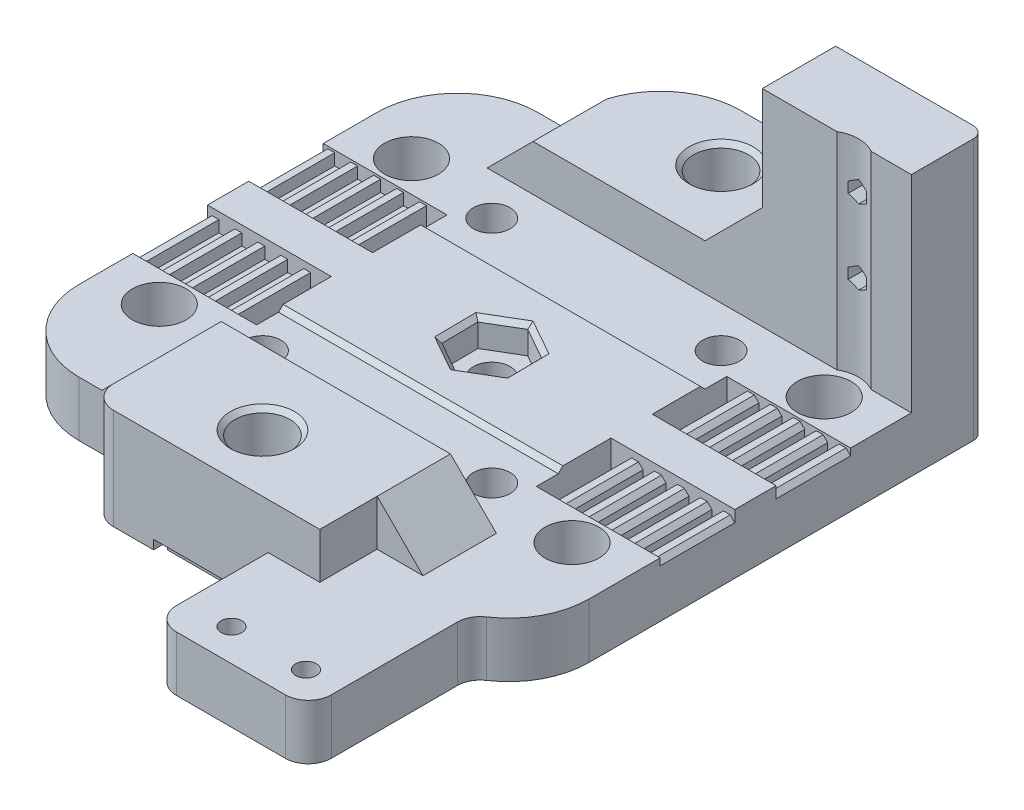
from build123d import *
from build123d.topology import SkipClean

# Parameters (mm, degrees)
SKETCH_1_W           = 40
SKETCH_1_H           = 40
EXTRUDE_1_DEPTH      = 4.8
SKETCH_2_R           = 1.6
CUT_EXTRUDE_1_DEPTH  = 57.771823997
SKETCH_3_W           = 40
SKETCH_3_H           = 12.8
EXTRUDE_2_DEPTH      = 0.4
CHAMFER_1_SIZE       = 0.4
SKETCH_4_W           = 20
SKETCH_4_H           = 5
EXTRUDE_3_DEPTH      = 4.8
SKETCH_5_R           = 1.6
CUT_EXTRUDE_2_DEPTH  = 61.43211067
SKETCH_6_W           = 9
SKETCH_6_H           = 50
CUT_EXTRUDE_4_DEPTH  = 0.8
SKETCH_7_W           = 20
SKETCH_7_H           = 11.5
SKETCH_7_R           = 1.6
EXTRUDE_4_DEPTH      = 4
SKETCH_8_R           = 2.4
CUT_EXTRUDE_5_DEPTH  = 4.4
CHAMFER_2_SIZE       = 0.4
CUT_EXTRUDE_6_DEPTH  = 2.4
CHAMFER_3_SIZE       = 0.4
EXTRUDE_5_DEPTH      = 3
EXTRUDE_6_DEPTH      = 3
SKETCH_12_W          = 1
SKETCH_12_H          = 6.5
CUT_EXTRUDE_7_DEPTH  = 1
SKETCH_13_W          = 1.8
SKETCH_13_H          = 6.5
CUT_EXTRUDE_8_DEPTH  = 63.860480431
SKETCH_14_W          = 10.8
SKETCH_14_H          = 6.5
SKETCH_14_H_2        = 6.513163602
CUT_EXTRUDE_9_DEPTH  = 0.6
SKETCH_15_W          = 1
SKETCH_15_H          = 6.5
CUT_EXTRUDE_10_DEPTH = 1
EXTRUDE_7_DEPTH      = 10
SKETCH_17_R          = 0.9
CUT_EXTRUDE_11_DEPTH = 71.366469288
SKETCH_18_W          = 7.5
SKETCH_18_H          = 4
CUT_EXTRUDE_12_DEPTH = 70.978853949
CHAMFER_4_SIZE       = 3
CHAMFER_4_SIZE2      = 1.091910703
SKETCH_20_W          = 7.8
SKETCH_20_H          = 48.8
EXTRUDE_9_DEPTH      = 0.6
SKETCH_21_W          = 0.8
SKETCH_21_H          = 0.2
SKETCH_21_W_2        = 0.4
CUT_EXTRUDE_13_DEPTH = 49
CHAMFER_5_SIZE       = 0.2
CHAMFER_6_SIZE       = 0.4
SKETCH_22_R          = 1.6
CUT_EXTRUDE_14_DEPTH = 10
SKETCH_24_R          = 2.35
CUT_EXTRUDE_15_DEPTH = 4
CHAMFER_8_SIZE       = 4
EXTRUDE_11_DEPTH     = 18
CHAMFER_11_SIZE      = 5
CHAMFER_12_SIZE      = 5
CHAMFER_13_SIZE      = 5
CUT_EXTRUDE_16_DEPTH = 15
SKETCH_29_W          = 5
SKETCH_29_H          = 4.8
EXTRUDE_13_DEPTH     = 9
SKETCH_30_W          = 15.5
SKETCH_30_H          = 10
CUT_EXTRUDE_17_DEPTH = 10
FILLET_1_R           = 2
FILLET_2_R           = 1
FILLET_3_R           = 7
FILLET_START         = -1
FILLET_4_DEPTH       = 14.8
SKETCH_32_W          = 28
SKETCH_32_H          = 0.1
SKETCH_32_W_2        = 37
CUT_EXTRUDE_18_DEPTH = 73.097156832


with BuildPart() as part:
    # 草图1 → 凸台-拉伸1 (new body)
    with BuildSketch(Plane(origin=(0, 0, 0), x_dir=(1, 0, 0), z_dir=(0, 1, 0))):
        with Locations((20, -20)):
            Rectangle(SKETCH_1_W, SKETCH_1_H)
    extrude(amount=EXTRUDE_1_DEPTH)

    # 草图2 → 切除-拉伸1 (cut, through all)
    with BuildSketch(Plane(origin=(0, 4.8, 0), x_dir=(1, 0, 0), z_dir=(0, 1, 0))):
        with Locations(Location((10, -30, 0), (0, 0, 270))):
            Circle(SKETCH_2_R)
        with Locations(Location((30, -30, 0), (0, 0, 270))):
            Circle(SKETCH_2_R)
        with Locations(Location((30, -10, 0), (0, 0, 270))):
            Circle(SKETCH_2_R)
        with Locations(Location((10, -10, 0), (0, 0, 270))):
            Circle(SKETCH_2_R)
    extrude(amount=-CUT_EXTRUDE_1_DEPTH, mode=Mode.SUBTRACT)

    # 草图3 → 凸台-拉伸2 (add)
    with BuildSketch(Plane(origin=(0, 4.8, 0), x_dir=(1, 0, 0), z_dir=(0, 1, 0))):
        with Locations((20, -20)):
            Rectangle(SKETCH_3_W, SKETCH_3_H)
    extrude(amount=EXTRUDE_2_DEPTH)

    # 倒角1
    chamfer_1_edges = [part.edges().sort_by_distance(p)[0] for p in [
        (20, 5.2, 26.4),
        (20, 5.2, 13.6),
    ]]
    chamfer(chamfer_1_edges, length=CHAMFER_1_SIZE - 0.0001)  # a hair under: the kernel refuses the full size

    # 草图4 → 凸台-拉伸3 (add)
    with BuildSketch(Plane.XZ):
        with Locations((20, 42.5)):
            Rectangle(SKETCH_4_W, SKETCH_4_H)
        with Locations((20, -2.5)):
            Rectangle(SKETCH_4_W, SKETCH_4_H)
    extrude(amount=-EXTRUDE_3_DEPTH)

    # 草图5 → 切除-拉伸2 (cut, through all)
    with BuildSketch(Plane(origin=(0, 0, 0), x_dir=(-1, 0, 0), z_dir=(0, -1, 0))):
        with Locations(Location((-20, -20, 0), (0, 0, 90))):
            Circle(SKETCH_5_R)
        with Locations(Location((-20, 0, 0), (0, 0, 90))):
            Circle(SKETCH_5_R)
        with Locations(Location((-20, -40, 0), (0, 0, 90))):
            Circle(SKETCH_5_R)
    extrude(amount=-CUT_EXTRUDE_2_DEPTH, mode=Mode.SUBTRACT)

    # 草图6 → 切除-拉伸4 (cut)
    with BuildSketch(Plane(origin=(0, 0, 0), x_dir=(-1, 0, 0), z_dir=(0, -1, 0))):
        with Locations((-20, -20)):
            Rectangle(SKETCH_6_W, SKETCH_6_H)
    extrude(amount=-CUT_EXTRUDE_4_DEPTH, mode=Mode.SUBTRACT)

    # 草图7 → 凸台-拉伸4 (add)
    # profile 1 of 2: a face of its own
    with BuildSketch(Plane(origin=(0, 4.8, 0), x_dir=(1, 0, 0), z_dir=(0, 1, 0))):
        with Locations((20, -0.75)):
            Rectangle(SKETCH_7_W, SKETCH_7_H)
        with Locations(Location((20, 0, 0), (0, 0, 90))):
            Circle(SKETCH_7_R, mode=Mode.SUBTRACT)
    # profile 2 of 2: a face of its own
    with BuildSketch(Plane(origin=(0, 4.8, 0), x_dir=(1, 0, 0), z_dir=(0, 1, 0))):
        with Locations((20, -39.25)):
            Rectangle(SKETCH_7_W, SKETCH_7_H)
        with Locations(Location((20, -40, 0), (0, 0, 90))):
            Circle(SKETCH_7_R, mode=Mode.SUBTRACT)
    extrude(amount=EXTRUDE_4_DEPTH)

    # 草图8 → 切除-拉伸5 (cut)
    with BuildSketch(Plane(origin=(0, 8.8, 0), x_dir=(1, 0, 0), z_dir=(0, 1, 0))):
        with Locations(Location((20, 0, 0), (0, 0, 270))):
            Circle(SKETCH_8_R)
        with Locations(Location((20, -40, 0), (0, 0, 270))):
            Circle(SKETCH_8_R)
    extrude(amount=-CUT_EXTRUDE_5_DEPTH, mode=Mode.SUBTRACT)

    # 倒角2
    chamfer_2_edges = [part.edges().sort_by_distance(p)[0] for p in [
        (20, 8.8, -2.4),
        (20, 8.8, 37.6),
    ]]
    chamfer(chamfer_2_edges, length=CHAMFER_2_SIZE)

    # 草图9 → 切除-拉伸6 (cut)
    with BuildSketch(Plane(origin=(0, 5.2, 0), x_dir=(1, 0, 0), z_dir=(0, 1, 0))):
        Polygon((22.76762404, -21.556788523), (22.732030429, -18.381561534), (19.964406389, -16.824773012), (17.23237596, -18.443211477), (17.267969571, -21.618438466), (20.035593611, -23.175226988), align=None)
    extrude(amount=-CUT_EXTRUDE_6_DEPTH, mode=Mode.SUBTRACT)

    # 倒角3
    chamfer_3_edges = [part.edges().sort_by_distance(p)[0] for p in [
        (21.401608826, 5.2, 22.366007756),
        (22.749827235, 5.2, 19.969175028),
        (21.348218409, 5.2, 17.603167273),
        (18.598391174, 5.2, 17.633992244),
        (17.250172765, 5.2, 20.030824972),
        (18.651781591, 5.2, 22.396832727),
    ]]
    chamfer(chamfer_3_edges, length=CHAMFER_3_SIZE)

    # 草图10 → 凸台-拉伸5 (add)
    with SkipClean():  # the faces are left unmerged after this step: merging them gives an invalid solid
        with BuildSketch(Plane(origin=(40, 0, 0), x_dir=(0, 0, -1), z_dir=(1, 0, 0))):
            Polygon((-14, 5.2), (-26, 5.2), (-26.4, 4.8), (-40, 4.8), (-40, 0), (0, 0), (0, 4.8), (-13.6, 4.8), align=None)
        extrude(amount=EXTRUDE_5_DEPTH)

    # 草图11 → 凸台-拉伸6 (add)
    with SkipClean():  # the faces are left unmerged after this step: merging them gives an invalid solid
        with BuildSketch(Plane.ZY):
            Polygon((40, 4.8), (26.4, 4.8), (26, 5.2), (14, 5.2), (13.6, 4.8), (0, 4.8), (0, 0), (40, 0), align=None)
        extrude(amount=EXTRUDE_6_DEPTH)

    # 草图12 → 切除-拉伸7 (cut)
    with SkipClean():  # the faces are left unmerged after this step: merging them gives an invalid solid
        with BuildSketch(Plane(origin=(0, 0, 0), x_dir=(-1, 0, 0), z_dir=(0, -1, 0))):
            with Locations((-0.5, -25.05)):
                Rectangle(SKETCH_12_W, SKETCH_12_H)
            with Locations((1.5, -25.05)):
                Rectangle(SKETCH_12_W, SKETCH_12_H)
            with Locations((-2.5, -25.05)):
                Rectangle(SKETCH_12_W, SKETCH_12_H)
            with Locations((-4.5, -25.05)):
                Rectangle(SKETCH_12_W, SKETCH_12_H)
            with Locations((-4.5, -14.95)):
                Rectangle(SKETCH_12_W, SKETCH_12_H)
            with Locations((-2.5, -14.95)):
                Rectangle(SKETCH_12_W, SKETCH_12_H)
            with Locations((-0.5, -14.95)):
                Rectangle(SKETCH_12_W, SKETCH_12_H)
            with Locations((1.5, -14.95)):
                Rectangle(SKETCH_12_W, SKETCH_12_H)
            with Locations((-35.5, -14.95)):
                Rectangle(SKETCH_12_W, SKETCH_12_H)
            with Locations((-37.5, -14.95)):
                Rectangle(SKETCH_12_W, SKETCH_12_H)
            with Locations((-39.5, -14.95)):
                Rectangle(SKETCH_12_W, SKETCH_12_H)
            with Locations((-41.5, -14.95)):
                Rectangle(SKETCH_12_W, SKETCH_12_H)
            with Locations((-35.5, -25.05)):
                Rectangle(SKETCH_12_W, SKETCH_12_H)
            with Locations((-37.5, -25.05)):
                Rectangle(SKETCH_12_W, SKETCH_12_H)
            with Locations((-39.5, -25.05)):
                Rectangle(SKETCH_12_W, SKETCH_12_H)
            with Locations((-41.5, -25.05)):
                Rectangle(SKETCH_12_W, SKETCH_12_H)
            with Locations((-6.5, -25.05)):
                Rectangle(SKETCH_12_W, SKETCH_12_H)
            with Locations((-6.5, -14.95)):
                Rectangle(SKETCH_12_W, SKETCH_12_H)
            with Locations((-33.5, -14.95)):
                Rectangle(SKETCH_12_W, SKETCH_12_H)
            with Locations((-33.5, -25.05)):
                Rectangle(SKETCH_12_W, SKETCH_12_H)
        extrude(amount=-CUT_EXTRUDE_7_DEPTH, mode=Mode.SUBTRACT)

    # 草图13 → 切除-拉伸8 (cut, through all)
    with SkipClean():  # the faces are left unmerged after this step: merging them gives an invalid solid
        with BuildSketch(Plane(origin=(0, 0, 0), x_dir=(-1, 0, 0), z_dir=(0, -1, 0))):
            with Locations((-33.1, -14.95)):
                Rectangle(SKETCH_13_W, SKETCH_13_H)
            with Locations((-33.1, -25.05)):
                Rectangle(SKETCH_13_W, SKETCH_13_H)
            with Locations((-6.9, -14.95)):
                Rectangle(SKETCH_13_W, SKETCH_13_H)
            with Locations((-6.9, -25.05)):
                Rectangle(SKETCH_13_W, SKETCH_13_H)
        extrude(amount=-CUT_EXTRUDE_8_DEPTH, mode=Mode.SUBTRACT)

    # 草图14 → 切除-拉伸9 (cut)
    with BuildSketch(Plane(origin=(0, 5.2, 0), x_dir=(1, 0, 0), z_dir=(0, 1, 0))):
        with Locations((2.4, -14.95)):
            Rectangle(SKETCH_14_W, SKETCH_14_H)
        with Locations((2.4, -25.056581801)):
            Rectangle(SKETCH_14_W, SKETCH_14_H_2)
        with Locations((37.6, -14.95)):
            Rectangle(SKETCH_14_W, SKETCH_14_H)
        with Locations((37.6, -25.056581801)):
            Rectangle(SKETCH_14_W, SKETCH_14_H_2)
    extrude(amount=-CUT_EXTRUDE_9_DEPTH, mode=Mode.SUBTRACT)

    # 草图15 → 切除-拉伸10 (cut)
    with BuildSketch(Plane(origin=(0, 4.6, 0), x_dir=(1, 0, 0), z_dir=(0, 1, 0))):
        with Locations((-1.5, -14.95)):
            Rectangle(SKETCH_15_W, SKETCH_15_H)
        with Locations((0.5, -14.95)):
            Rectangle(SKETCH_15_W, SKETCH_15_H)
        with Locations((2.5, -14.95)):
            Rectangle(SKETCH_15_W, SKETCH_15_H)
        with Locations((4.5, -14.95)):
            Rectangle(SKETCH_15_W, SKETCH_15_H)
        with Locations((35.5, -14.95)):
            Rectangle(SKETCH_15_W, SKETCH_15_H)
        with Locations((37.5, -14.95)):
            Rectangle(SKETCH_15_W, SKETCH_15_H)
        with Locations((39.5, -14.95)):
            Rectangle(SKETCH_15_W, SKETCH_15_H)
        with Locations((41.5, -14.95)):
            Rectangle(SKETCH_15_W, SKETCH_15_H)
        with Locations((41.5, -25.05)):
            Rectangle(SKETCH_15_W, SKETCH_15_H)
        with Locations((39.5, -25.05)):
            Rectangle(SKETCH_15_W, SKETCH_15_H)
        with Locations((37.5, -25.05)):
            Rectangle(SKETCH_15_W, SKETCH_15_H)
        with Locations((35.5, -25.05)):
            Rectangle(SKETCH_15_W, SKETCH_15_H)
        with Locations((4.5, -25.05)):
            Rectangle(SKETCH_15_W, SKETCH_15_H)
        with Locations((2.5, -25.05)):
            Rectangle(SKETCH_15_W, SKETCH_15_H)
        with Locations((0.5, -25.05)):
            Rectangle(SKETCH_15_W, SKETCH_15_H)
        with Locations((-1.5, -25.05)):
            Rectangle(SKETCH_15_W, SKETCH_15_H)
    extrude(amount=-CUT_EXTRUDE_10_DEPTH, mode=Mode.SUBTRACT)

    # 草图16 → 凸台-拉伸7 (add)
    with BuildSketch(Plane.XY.offset(45)):
        Polygon((30, 0), (10, 0), (10, 4.8), (30, 4.8), (39, 4.8), (39, 0), align=None)
    extrude(amount=EXTRUDE_7_DEPTH)

    # 草图17 → 切除-拉伸11 (cut, through all)
    with BuildSketch(Plane(origin=(0, 0, 0), x_dir=(-1, 0, 0), z_dir=(0, -1, 0))):
        with Locations(Location((-29.5, -52.2, 0), (0, 0, 90))):
            Circle(SKETCH_17_R)
        with Locations(Location((-36, -52.2, 0), (0, 0, 90))):
            Circle(SKETCH_17_R)
    extrude(amount=-CUT_EXTRUDE_11_DEPTH, mode=Mode.SUBTRACT)

    # 草图18 → 切除-拉伸12 (cut, through all)
    with BuildSketch(Plane(origin=(0, 4.8, 0), x_dir=(1, 0, 0), z_dir=(0, 1, 0))):
        with Locations((13.75, -53)):
            Rectangle(SKETCH_18_W, SKETCH_18_H)
    extrude(amount=-CUT_EXTRUDE_12_DEPTH, mode=Mode.SUBTRACT)

    # 倒角4
    chamfer_4_edges = [part.edges().sort_by_distance(p)[0] for p in [
        (17.5, 2.4, 55),
    ]]
    chamfer_4_side = [part.faces().sort_by_distance(p)[0] for p in [
        (28.25, 2.4, 55),
    ]]
    chamfer(chamfer_4_edges, length=CHAMFER_4_SIZE, length2=CHAMFER_4_SIZE2, reference=chamfer_4_side[0])

    # 倒角5
    chamfer_5_edges = [part.edges().sort_by_distance(p)[0] for p in [
        (36, 0, 25.05),
        (42, 0, 14.95),
        (40, 0, 14.95),
        (38, 0, 14.95),
        (6, 0, 14.95),
        (42, 0, 25.05),
        (40, 0, 25.05),
        (38, 0, 25.05),
        (0, 0, 25.05),
        (2, 0, 25.05),
        (4, 0, 25.05),
        (4, 0, 14.95),
        (36, 0, 14.95),
        (-2, 0, 14.95),
        (0, 0, 14.95),
        (2, 0, 14.95),
        (6, 0, 25.05),
        (-2, 0, 25.05),
    ]]
    chamfer(chamfer_5_edges, length=CHAMFER_5_SIZE)

    # 倒角6
    chamfer_6_edges = [part.edges().sort_by_distance(p)[0] for p in [
        (-3, 4.6, 25.056581801),
        (43, 4.6, 14.95),
        (43, 4.6, 25.056581801),
        (-3, 4.6, 14.95),
        (5, 4.6, 14.95),
        (3, 4.6, 14.95),
        (35, 4.6, 14.95),
        (1, 4.6, 14.95),
        (37, 4.6, 14.95),
        (39, 4.6, 14.95),
        (41, 4.6, 14.95),
        (41, 4.6, 25.05),
        (39, 4.6, 25.05),
        (37, 4.6, 25.05),
        (35, 4.6, 25.05),
        (5, 4.6, 25.05),
        (3, 4.6, 25.05),
        (1, 4.6, 25.05),
        (-1, 4.6, 25.05),
        (-1, 4.6, 14.95),
    ]]
    chamfer(chamfer_6_edges, length=CHAMFER_6_SIZE)

    # 草图22 → 切除-拉伸14 (cut)
    with BuildSketch(Plane(origin=(0, 4.8, 0), x_dir=(1, 0, 0), z_dir=(0, 1, 0))):
        with Locations(Location((38, -31, 0), (0, 0, 270))):
            Circle(SKETCH_22_R)
        with Locations(Location((38, -9, 0), (0, 0, 270))):
            Circle(SKETCH_22_R)
        with Locations(Location((2, -9, 0), (0, 0, 270))):
            Circle(SKETCH_22_R)
        with Locations(Location((2, -31, 0), (0, 0, 270))):
            Circle(SKETCH_22_R)
    extrude(amount=-CUT_EXTRUDE_14_DEPTH, mode=Mode.SUBTRACT)

    # 草图24 → 切除-拉伸15 (cut)
    with BuildSketch(Plane(origin=(0, 4.8, 0), x_dir=(1, 0, 0), z_dir=(0, 1, 0))):
        with Locations(Location((2, -31, 0), (0, 0, 270))):
            Circle(SKETCH_24_R)
        with Locations(Location((38, -9, 0), (0, 0, 270))):
            Circle(SKETCH_24_R)
        with Locations(Location((38, -31, 0), (0, 0, 270))):
            Circle(SKETCH_24_R)
        with Locations(Location((2, -9, 0), (0, 0, 270))):
            Circle(SKETCH_24_R)
    extrude(amount=-CUT_EXTRUDE_15_DEPTH, mode=Mode.SUBTRACT)

    # 倒角8
    chamfer_8_edges = [part.edges().sort_by_distance(p)[0] for p in [
        (10, 4.8, 36.75),
        (10, 4.8, 3.25),
        (30, 4.8, 36.75),
        (30, 4.8, 3.25),
    ]]
    chamfer(chamfer_8_edges, length=CHAMFER_8_SIZE - 0.0001)  # a hair under: the kernel refuses the full size

    # 草图25 → 凸台-拉伸11 (add)
    with BuildSketch(Plane(origin=(0, 4.8, 0), x_dir=(1, 0, 0), z_dir=(0, 1, 0))):
        with BuildLine():
            Line((30, 0), (43, 0))
            Line((43, 0), (43, -6.5))
            Line((43, -6.5), (40.482606158, -6.5))
            Line((40.482606158, -6.5), (39.658312395, -6.5))
            ThreePointArc((39.658312395, -6.5), (38, -6), (36.341687605, -6.5))
            Line((36.341687605, -6.5), (34.637382035, -6.5))
            Line((34.637382035, -6.5), (30, -6.5))
            Line((30, -6.5), (30, 0))
        make_face()
    extrude(amount=EXTRUDE_11_DEPTH)

    # 倒角11
    chamfer_11_edges = [part.edges().sort_by_distance(p)[0] for p in [
        (30, 8.8, 3.25),
    ]]
    chamfer(chamfer_11_edges, length=CHAMFER_11_SIZE)

    # 倒角12
    chamfer_12_edges = [part.edges().sort_by_distance(p)[0] for p in [
        (30, 4.39995, 0),
    ]]
    chamfer(chamfer_12_edges, length=CHAMFER_12_SIZE - 0.0001)  # a hair under: the kernel refuses the full size

    # 倒角13
    # the kernel refuses this chamfer: 5 mm, written as the material it adds along each edge
    with BuildSketch(Plane(origin=(12.14158506, 8.8, 0), x_dir=(0, 0, -1), z_dir=(1, 0, 0))) as chamfer_13_piece_1_section:
        Polygon((CHAMFER_13_SIZE, 0), (0, CHAMFER_13_SIZE), (0, 0), align=None)
    chamfer_13_piece_1 = extrude(amount=35.71672988, mode=Mode.PRIVATE)
    chamfer_13_piece_1 = split(chamfer_13_piece_1, bisect_by=Plane(origin=(18.57079253, 2.37079253, 0), z_dir=(0.7071067811865476, -0.7071067811865476, 0)), keep=Keep.TOP, mode=Mode.PRIVATE)
    chamfer_13_piece_1 = split(chamfer_13_piece_1, bisect_by=Plane(origin=(12.14158506, 8.8, -5), z_dir=(0, 0, 1)), keep=Keep.TOP, mode=Mode.PRIVATE)
    chamfer_13_piece_1 = split(chamfer_13_piece_1, bisect_by=Plane(origin=(30, 8.8, 0), z_dir=(-1, 0, 0)), keep=Keep.TOP, mode=Mode.PRIVATE)
    add(chamfer_13_piece_1)
    with BuildSketch(Plane(origin=(12.14158506, 8.8, 0), x_dir=(0, 0, -1), z_dir=(1, 0, 0))) as chamfer_13_piece_2_section:
        Polygon((CHAMFER_13_SIZE, 0), (0, CHAMFER_13_SIZE), (0, 0), align=None)
    chamfer_13_piece_2 = extrude(amount=35.71672988, mode=Mode.PRIVATE)
    chamfer_13_piece_2 = split(chamfer_13_piece_2, bisect_by=Plane(origin=(23.57074253, 8.8, -11.42915747), z_dir=(-0.7071067811865476, 0, 0.7071067811865476)), keep=Keep.TOP, mode=Mode.PRIVATE)
    chamfer_13_piece_2 = split(chamfer_13_piece_2, bisect_by=Plane(origin=(18.57079253, 2.37079253, 0), z_dir=(0.7071067811865476, -0.7071067811865476, 0)), keep=Keep.TOP, mode=Mode.PRIVATE)
    chamfer_13_piece_2 = split(chamfer_13_piece_2, bisect_by=Plane(origin=(30, 8.8, 0), z_dir=(1, 0, 0)), keep=Keep.TOP, mode=Mode.PRIVATE)
    add(chamfer_13_piece_2)

    # 草图26 → 切除-拉伸16 (cut)
    with BuildSketch(Plane(origin=(0, 0, 0), x_dir=(-1, 0, 0), z_dir=(0, 0, -1))):
        Polygon((-38, 19.723760431), (-38.8, 19.261880215), (-38.8, 18.338119785), (-38, 17.876239569), (-37.2, 18.338119785), (-37.2, 19.261880215), align=None)
        Polygon((-38, 13.223760431), (-38.8, 12.761880215), (-38.8, 11.838119785), (-38, 11.376239569), (-37.2, 11.838119785), (-37.2, 12.761880215), align=None)
    extrude(amount=-CUT_EXTRUDE_16_DEPTH, mode=Mode.SUBTRACT)

    # 草图29 → 凸台-拉伸13 (add)
    with BuildSketch(Plane(origin=(30, 0, 0), x_dir=(0, 0, -1), z_dir=(1, 0, 0))):
        with Locations((-42.5, 2.4)):
            Rectangle(SKETCH_29_W, SKETCH_29_H)
    extrude(amount=EXTRUDE_13_DEPTH)

    # 草图30 → 切除-拉伸17 (cut)
    with BuildSketch(Plane(origin=(0, 4.8, 0), x_dir=(1, 0, 0), z_dir=(0, 1, 0))):
        with Locations((17.75, -50)):
            Rectangle(SKETCH_30_W, SKETCH_30_H)
    extrude(amount=-CUT_EXTRUDE_17_DEPTH, mode=Mode.SUBTRACT)

    # 圆角1
    fillet_1_edges = [part.edges().sort_by_distance(p)[0] for p in [
        (39, 2.4, 40),
        (25.5, 2.4, 55),
        (10, 4.39995, 40),
        (10, 4.4, 45),
        (39, 2.4, 55),
    ]]
    fillet(fillet_1_edges, radius=FILLET_1_R)

    # 圆角2
    fillet_2_edges = [part.edges().sort_by_distance(p)[0] for p in [
        (43, 11.4, 0),
    ]]
    fillet(fillet_2_edges, radius=FILLET_2_R)

    # 圆角3
    fillet_3_edges = [part.edges().sort_by_distance(p)[0] for p in [
        (41, 2.4, 40),
        (43, 2.4, 40),
        (-3, 2.4, 40),
        (-3, 2.4, 0),
    ]]
    fillet(fillet_3_edges, radius=FILLET_3_R)

    # 圆角4: read off the stored shape, not the designer's step
    # 圆角4 outline → 圆角4 (cut)
    with BuildSketch(Plane(origin=(0, 0, 0), x_dir=(1, 0, 0), z_dir=(0, 1, 0)).offset(FILLET_START)):
        with BuildLine():
            ThreePointArc((10, 0), (12.5249038, 3.61248608), (16.708203932, 5))
            Line((16.708203932, 5), (10, 5))
            Line((10, 5), (10, 0))
        make_face()
        with BuildLine():
            ThreePointArc((27.100505063, 5), (29.77928909, 4.467156728), (32.050252532, 2.949747468))
            Line((32.050252532, 2.949747468), (30, 5))
            Line((30, 5), (27.100505063, 5))
        make_face()
    extrude(amount=FILLET_4_DEPTH, mode=Mode.SUBTRACT)

    # 草图32 → 切除-拉伸18 (cut, through all)
    with BuildSketch(Plane(origin=(0, 4.8, 0), x_dir=(1, 0, 0), z_dir=(0, 1, 0))):
        with Locations((20, -33.55)):
            Rectangle(SKETCH_32_W, SKETCH_32_H)
        with Locations((24.5, -6.45)):
            Rectangle(SKETCH_32_W_2, SKETCH_32_H)
    extrude(amount=CUT_EXTRUDE_18_DEPTH, mode=Mode.SUBTRACT)


with BuildPart() as body_2:
    # 草图20 → 凸台-拉伸9 (new body)
    with BuildSketch(Plane(origin=(0, 0, 0), x_dir=(-1, 0, 0), z_dir=(0, -1, 0))):
        with Locations((-20, -20)):
            Rectangle(SKETCH_20_W, SKETCH_20_H)
    extrude(amount=-EXTRUDE_9_DEPTH)

    # 草图21 → 切除-拉伸13 (cut)
    with BuildSketch(Plane(origin=(0, 0, -4.4), x_dir=(-1, 0, 0), z_dir=(0, 0, -1))):
        with Locations((-22.7, 0.5)):
            Rectangle(SKETCH_21_W, SKETCH_21_H)
        with Locations((-21.076728368, 0.5)):
            Rectangle(SKETCH_21_W, SKETCH_21_H)
        with Locations((-19.453456736, 0.5)):
            Rectangle(SKETCH_21_W, SKETCH_21_H)
        with Locations((-17.830185104, 0.5)):
            Rectangle(SKETCH_21_W, SKETCH_21_H)
        with Locations((-16.830185104, 0.5)):
            Rectangle(SKETCH_21_W_2, SKETCH_21_H)
    extrude(amount=-CUT_EXTRUDE_13_DEPTH, mode=Mode.SUBTRACT)


solid = Compound([part.part, body_2.part])
